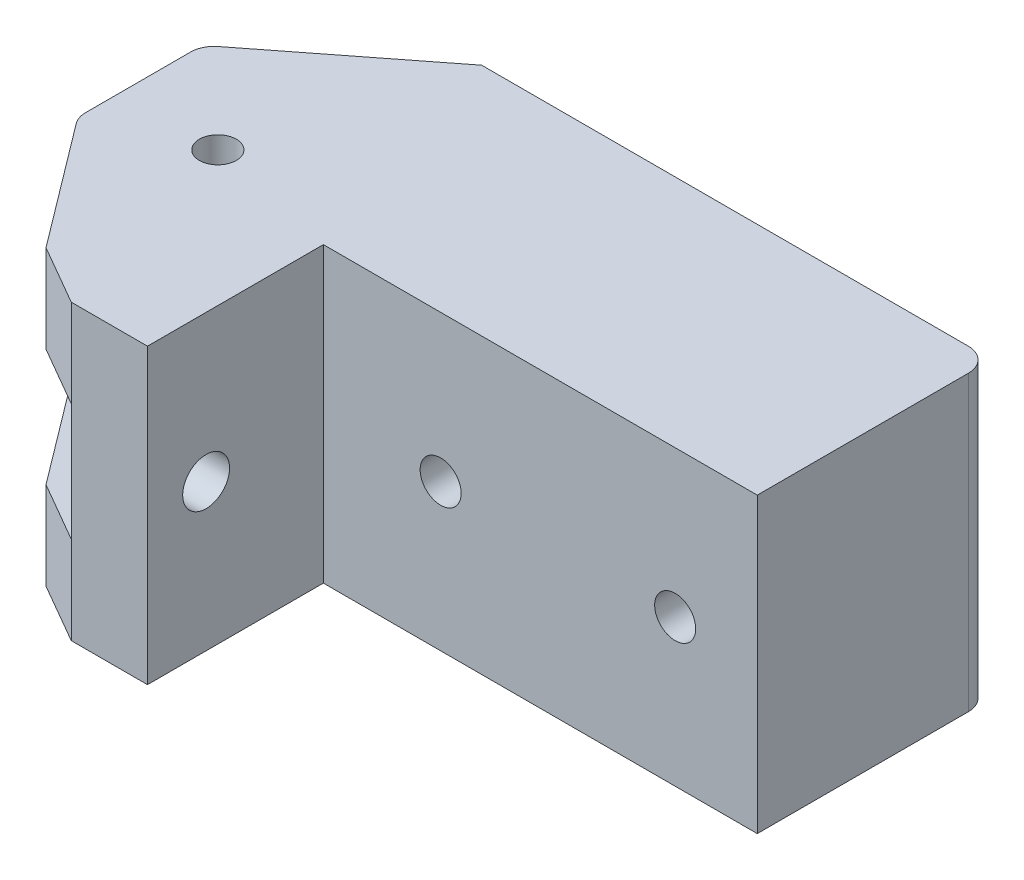
from build123d import *

# Parameters (mm, degrees)
SKETCH1_R           = 1.575
BOSS_EXTRUDE1_DEPTH = 12.5
SKETCH2_W           = 13.385271969
SKETCH2_H           = 10
CUT_EXTRUDE1_DEPTH  = 68.949865099
SKETCH3_R           = 1.75
CUT_EXTRUDE2_DEPTH  = 25
SKETCH4_R           = 4
CUT_EXTRUDE3_DEPTH  = 4
FILLET1_R           = 2
SKETCH5_R           = 2
CUT_EXTRUDE4_DEPTH  = 10
SKETCH7_R           = 3.575
CUT_EXTRUDE5_DEPTH  = 3.5


with BuildPart() as part:
    # Sketch1 → Boss-Extrude1 (new, symmetric)
    with BuildSketch(Plane(origin=(0, 0, 0), x_dir=(1, 0, 0), z_dir=(0, 1, 0))):
        Polygon((0, 0), (-43.5, 0), (-56.885271969, -10.457720596), (-56.885271969, -21.057720596), (-48.596177418, -32.057720596), (-43.5, -35), (-37, -35), (-37, -20), (0, -20), align=None)
        with Locations((-48.5, -17.5)):
            Circle(SKETCH1_R, mode=Mode.SUBTRACT)
    extrude(amount=BOSS_EXTRUDE1_DEPTH, both=True)

    # Sketch2 → Cut-Extrude1 (cut, through all)
    with BuildSketch(Plane.XY.offset(35)):
        with Locations((-50.192635985, 0)):
            Rectangle(SKETCH2_W, SKETCH2_H)
    extrude(amount=-CUT_EXTRUDE1_DEPTH, mode=Mode.SUBTRACT)

    # Sketch3 → Cut-Extrude2 (cut)
    with BuildSketch(Plane.XY.offset(20)):
        with Locations((-27, 0)):
            Circle(SKETCH3_R)
        with Locations((-7, 0)):
            Circle(SKETCH3_R)
    extrude(amount=-CUT_EXTRUDE2_DEPTH, mode=Mode.SUBTRACT)

    # Sketch4 → Cut-Extrude3 (cut)
    with BuildSketch(Plane(origin=(0, 0, 0), x_dir=(-1, 0, 0), z_dir=(0, 0, -1))):
        with Locations((7, 0)):
            Circle(SKETCH4_R)
        with Locations((27, 0)):
            Circle(SKETCH4_R)
    extrude(amount=-CUT_EXTRUDE3_DEPTH, mode=Mode.SUBTRACT)

    # Fillet1
    fillet1_edges = [part.edges().sort_by_distance(p)[0] for p in [
        (0, 0, 0),
        (-56.885271969, 8.75, 10.457720596),
        (-56.885271969, 8.75, 21.057720596),
        (-56.885271969, -8.75, 21.057720596),
        (-56.885271969, -8.75, 10.457720596),
    ]]
    fillet(fillet1_edges, radius=FILLET1_R)

    # Sketch5 → Cut-Extrude4 (cut)
    with BuildSketch(Plane.ZY.offset(43.5)):
        with Locations((30, 0)):
            Circle(SKETCH5_R)
    extrude(amount=-CUT_EXTRUDE4_DEPTH, mode=Mode.SUBTRACT)

    # Sketch7 → Cut-Extrude5 (cut)
    with BuildSketch(Plane.ZY.offset(43.5)):
        with Locations((30, 0)):
            Circle(SKETCH7_R)
    extrude(amount=-CUT_EXTRUDE5_DEPTH, mode=Mode.SUBTRACT)


solid = part.part
